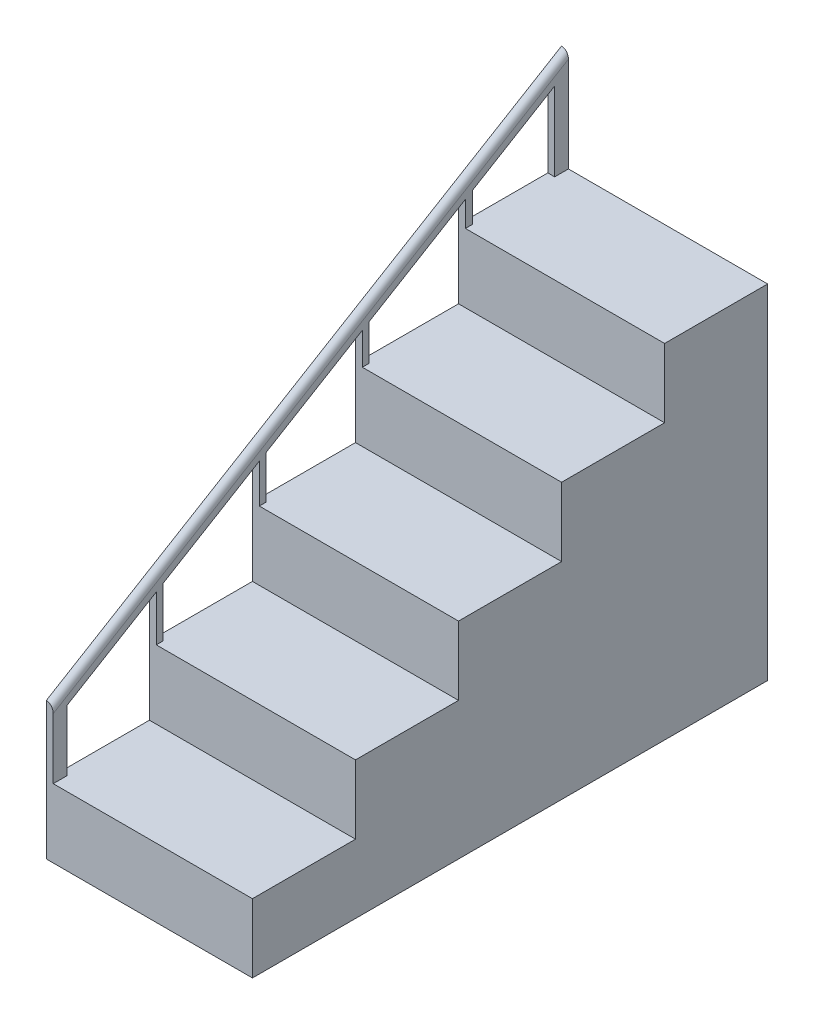
from build123d import *

# Parameters (mm, degrees)
BOSS_EXTRUDE1_DEPTH = 300
BOSS_EXTRUDE4_DEPTH = 10
BOSS_EXTRUDE5_DEPTH = 10
FILLET1_R           = 10


with BuildPart() as part:
    # Sketch1 → Boss-Extrude1 (new body)
    with BuildSketch(Plane(origin=(0, 0, 0), x_dir=(0, 0, -1), z_dir=(1, 0, 0))):
        Polygon((0, 0), (0, 100), (150, 100), (150, 200), (300, 200), (300, 300), (450, 300), (450, 400), (600, 400), (600, 500), (750, 500), (750, 0), align=None)
    extrude(amount=BOSS_EXTRUDE1_DEPTH)

    # Sketch5 → Boss-Extrude4 (add)
    with BuildSketch(Plane.ZY):
        Polygon((-750, 500), (-750, 650), (0, 200), (0, 100), (-20, 100), (-20, 188.676192421), (-730, 614.676192421), (-730, 500), align=None)
    extrude(amount=-BOSS_EXTRUDE4_DEPTH)

    # Sketch8 → Boss-Extrude5 (add)
    with BuildSketch(Plane.ZY):
        Polygon((-600, 500), (-600, 536.676192421), (-610, 542.676192421), (-610, 536.676192421), (-610, 500), align=None)
        Polygon((-450, 400), (-450, 446.676192421), (-460, 452.676192421), (-460, 446.676192421), (-460, 400), align=None)
        Polygon((-300, 300), (-300, 356.676192421), (-310, 362.676192421), (-310, 356.676192421), (-310, 300), align=None)
        Polygon((-150, 200), (-150, 266.676192421), (-160, 272.676192421), (-160, 266.676192421), (-160, 200), align=None)
    extrude(amount=-BOSS_EXTRUDE5_DEPTH)

    # Fillet1
    fillet1_edges = [part.edges().sort_by_distance(p)[0] for p in [
        (10, 425, -375),
    ]]
    fillet(fillet1_edges, radius=FILLET1_R - 0.0001)  # a hair under: the kernel refuses the full size


solid = part.part
